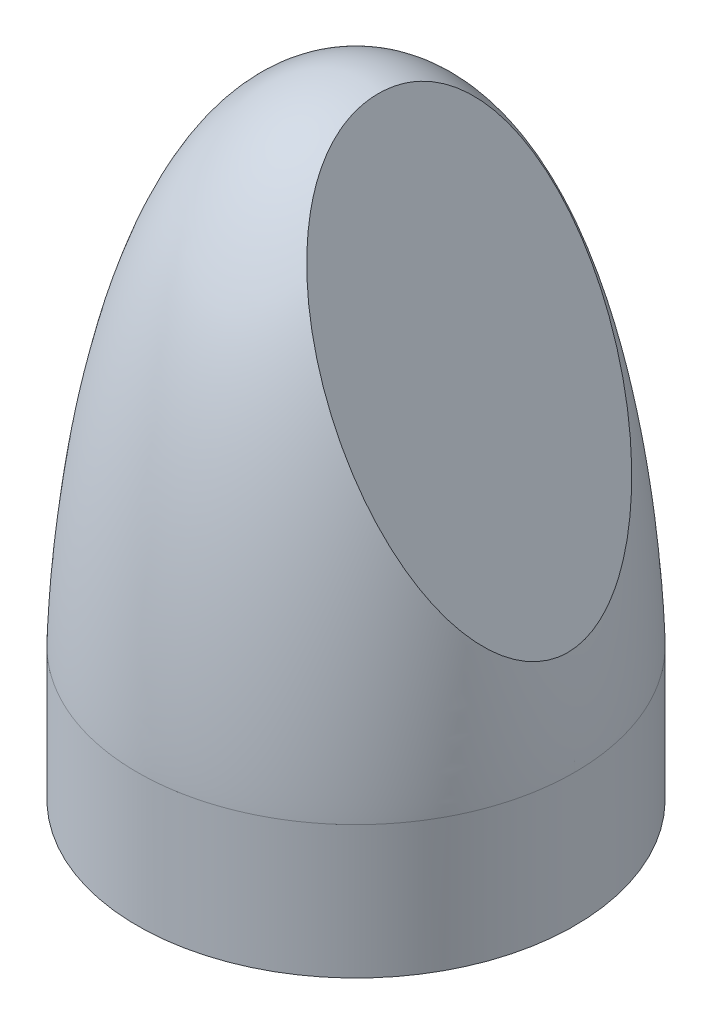
from build123d import *

# Parameters (mm, degrees)
SCALE2_SCALE           = 2
CUT_EXTRUDE1_START     = 15.280040905
CUT_EXTRUDE1_OUTLINE_W = 31
CUT_EXTRUDE1_OUTLINE_H = 20
CUT_EXTRUDE1_DEPTH     = 3.866864707


# Read off the part's stored shape, not the designer's step: Cut-Extrude1
with BuildPart() as part:
    # Sketch1 → Revolve1 (revolve)
    with BuildSketch(Plane.XY, mode=Mode.PRIVATE) as revolve1_sk:
        with BuildLine():
            Line((7, 4.256292026), (7, 0))
            Line((7, 0), (0, 0))
            Line((0, 0), (0, 20))
            add(Edge.make_bspline(
                [(0, 20), (6.748759859, 19.983290112), (7.005059619, 4.256663996), (7, 4.256292026)],
                knots=[0, 0, 0, 0, 0.166417438, 0.166417438, 0.166417438, 0.166417438], degree=3))
        make_face()
    revolve(revolve1_sk.sketch.rotate(Axis((0, 0, 0), (0, 1, 0)), 90), axis=Axis((0, 0, 0), (0, 1, 0)))


with BuildPart() as part_1:
    # Scale2: scaled about (0, 7.913014441, 0)
    add(part.part.scale(SCALE2_SCALE).moved(Location((0, -7.913014441, 0))))

    # Cut-Extrude1 outline → Cut-Extrude1 (cut)
    with BuildSketch(Plane(origin=(0, 0, 0), x_dir=(0.43801694528234036, -0.8989667155381935, 0), z_dir=(0.8989667155381934, 0.4380169452823407, 0)).offset(CUT_EXTRUDE1_START)):
        with Locations((-14.5, 0)):
            Rectangle(CUT_EXTRUDE1_OUTLINE_W, CUT_EXTRUDE1_OUTLINE_H)
    extrude(amount=CUT_EXTRUDE1_DEPTH, mode=Mode.SUBTRACT)


solid = part_1.part
